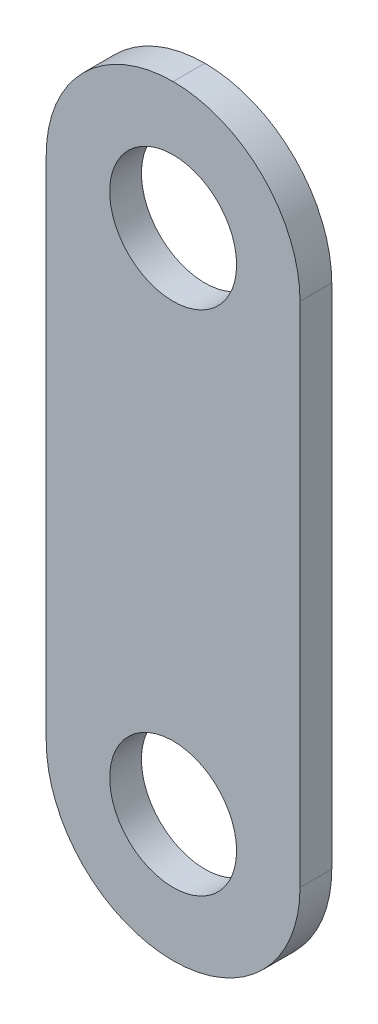
from build123d import *

# Parameters (mm, degrees)
SKETCH1_W           = 12.7
SKETCH1_H           = 38.1
SKETCH1_R           = 3.175
BOSS_EXTRUDE1_DEPTH = 1.5875
FILLET1_R           = 6.35


with BuildPart() as part:
    # Sketch1 → Boss-Extrude1 (new body)
    with BuildSketch(Plane.XY):
        with Locations((6.35, 19.05)):
            Rectangle(SKETCH1_W, SKETCH1_H)
        with Locations((6.35, 31.75)):
            Circle(SKETCH1_R, mode=Mode.SUBTRACT)
        with Locations((6.35, 6.35)):
            Circle(SKETCH1_R, mode=Mode.SUBTRACT)
    extrude(amount=BOSS_EXTRUDE1_DEPTH)

    # Fillet1
    fillet1_edges = [part.edges().sort_by_distance(p)[0] for p in [
        (12.7, 38.1, 0.79375),
        (0, 38.1, 0.79375),
        (0, 0, 0.79375),
        (12.7, 0, 0.79375),
    ]]
    fillet(fillet1_edges, radius=FILLET1_R - 0.0001)  # a hair under: the kernel refuses the full size


solid = part.part
